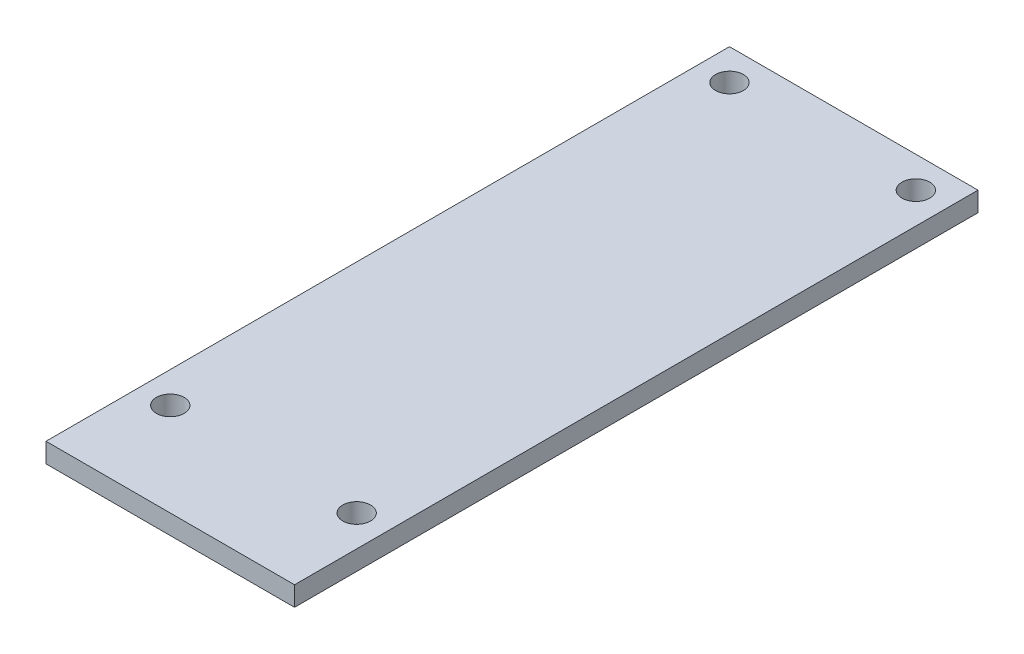
from build123d import *

# Parameters (mm, degrees)
SKETCH1_W           = 25.4
SKETCH1_H           = 69.85
BOSS_EXTRUDE1_DEPTH = 2
SKETCH2_R           = 1.4224
CUT_EXTRUDE1_DEPTH  = 2


with BuildPart() as part:
    # Sketch1 → Boss-Extrude1 (new body)
    with BuildSketch(Plane(origin=(0, 0, 0), x_dir=(1, 0, 0), z_dir=(0, 1, 0))):
        with Locations((12.7, 34.925)):
            Rectangle(SKETCH1_W, SKETCH1_H)
    extrude(amount=BOSS_EXTRUDE1_DEPTH)

    # Sketch2 → Cut-Extrude1 (cut)
    with BuildSketch(Plane(origin=(0, 2, 0), x_dir=(1, 0, 0), z_dir=(0, 1, 0))):
        with Locations((3.175, 66.675)):
            Circle(SKETCH2_R)
        with Locations((22.225, 66.675)):
            Circle(SKETCH2_R)
        with Locations((3.175, 9.525)):
            Circle(SKETCH2_R)
        with Locations((22.225, 9.525)):
            Circle(SKETCH2_R)
    extrude(amount=-CUT_EXTRUDE1_DEPTH, mode=Mode.SUBTRACT)


solid = part.part
